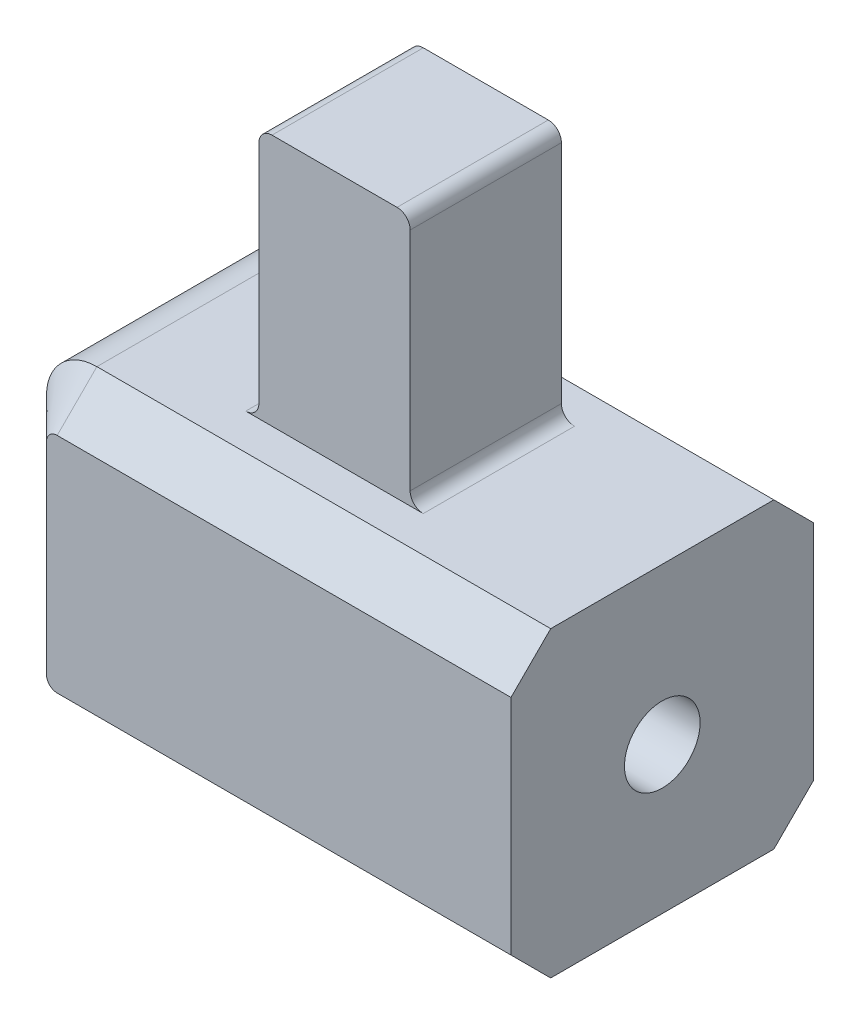
from build123d import *

# Parameters (mm, degrees)
SKETCH2_W                      = 127
SKETCH2_H                      = 76.2
BOSS_EXTRUDE2_DEPTH            = 76.2
FILLET1_R                      = 12.7
CHAMFER1_SIZE                  = 10
F_3_4_0_7500_DOWEL_HOLE1_D     = 19.05
F_3_4_0_7500_DOWEL_HOLE1_DEPTH = 76.2
F_3_4_0_7500_DOWEL_HOLE1_TIP   = 5.723197396
SKETCH9_W                      = 38.1
SKETCH9_H                      = 38.1
BOSS_EXTRUDE3_DEPTH            = 63.5
FILLET2_R                      = 3.302


# Read off the part's stored shape, not the designer's step: 1/4-20 Tapped Hole1
with BuildPart() as part:
    # Sketch2 → Boss-Extrude2 (new body)
    with BuildSketch(Plane(origin=(0, 0, 0), x_dir=(1, 0, 0), z_dir=(0, 1, 0))):
        Rectangle(SKETCH2_W, SKETCH2_H)
    extrude(amount=BOSS_EXTRUDE2_DEPTH)

    # Fillet1
    fillet1_edges = [part.edges().sort_by_distance(p)[0] for p in [
        (-63.5, 76.2, 0),
        (-63.5, 0, 0),
    ]]
    fillet(fillet1_edges, radius=FILLET1_R)

    # Chamfer1
    chamfer1_edges = [part.edges().sort_by_distance(p)[0] for p in [
        (-63.5, 38.1, 38.1),
        (-63.5, 38.1, -38.1),
        (6.35, 0, 38.1),
        (6.35, 76.2, 38.1),
        (-59.780256121, 72.480256121, 38.1),
        (-59.780256121, 3.719743879, 38.1),
        (-59.780256121, 72.480256121, -38.1),
        (-59.780256121, 3.719743879, -38.1),
        (6.35, 0, -38.1),
        (6.35, 76.2, -38.1),
    ]]
    chamfer(chamfer1_edges, length=CHAMFER1_SIZE)

    # 3/4 (0.7500) Dowel Hole1
    with Locations(Plane(origin=(63.5, 0, 0), x_dir=(0, 0, -1), z_dir=(1, 0, 0))):
        with Locations((0, 36.890636669)):
            Hole(F_3_4_0_7500_DOWEL_HOLE1_D / 2, depth=F_3_4_0_7500_DOWEL_HOLE1_DEPTH)
            with Locations((0, 0, -(F_3_4_0_7500_DOWEL_HOLE1_DEPTH + F_3_4_0_7500_DOWEL_HOLE1_TIP / 2))):  # 118° drill point
                Cone(0, F_3_4_0_7500_DOWEL_HOLE1_D / 2, F_3_4_0_7500_DOWEL_HOLE1_TIP, mode=Mode.SUBTRACT)

    # 1/4-20 Tapped Hole1 outline → 1/4-20 Tapped Hole1 (revolve, cut)
    with BuildSketch(Plane(origin=(9.290251981, 0, 0), x_dir=(1, 0, 0), z_dir=(0, 0, 1))):
        Polygon((2.145213652, 27.610479168), (0, 27.610479168), (0, 0), (2.5527, 0), (2.5527, 27.365636669), align=None)
    revolve(axis=Axis((9.290251981, 0, 0), (0, 1, 0)), mode=Mode.SUBTRACT)

    # 1_4-20 Tapped Hole1 2 outline → 1_4-20 Tapped Hole1 2 (revolve, cut)
    with BuildSketch(Plane(origin=(36.474004082, 0, 0), x_dir=(1, 0, 0), z_dir=(0, 0, 1))):
        Polygon((2.5527, 0), (2.5527, 27.365636669), (2.145213678, 27.610479152), (0, 27.610479152), (0, 0), align=None)
    revolve(axis=Axis((36.474004082, 0, 0), (0, 1, 0)), mode=Mode.SUBTRACT)

    # Sketch9 → Boss-Extrude3 (add)
    with BuildSketch(Plane(origin=(0, 76.2, 0), x_dir=(1, 0, 0), z_dir=(0, 1, 0))):
        Rectangle(SKETCH9_W, SKETCH9_H)
    extrude(amount=BOSS_EXTRUDE3_DEPTH)

    # Fillet2
    fillet2_edges = [part.edges().sort_by_distance(p)[0] for p in [
        (19.05, 76.2, 0),
        (-19.05, 76.2, 0),
        (19.05, 139.7, 0),
        (-19.05, 139.7, 0),
    ]]
    fillet(fillet2_edges, radius=FILLET2_R)


solid = part.part
